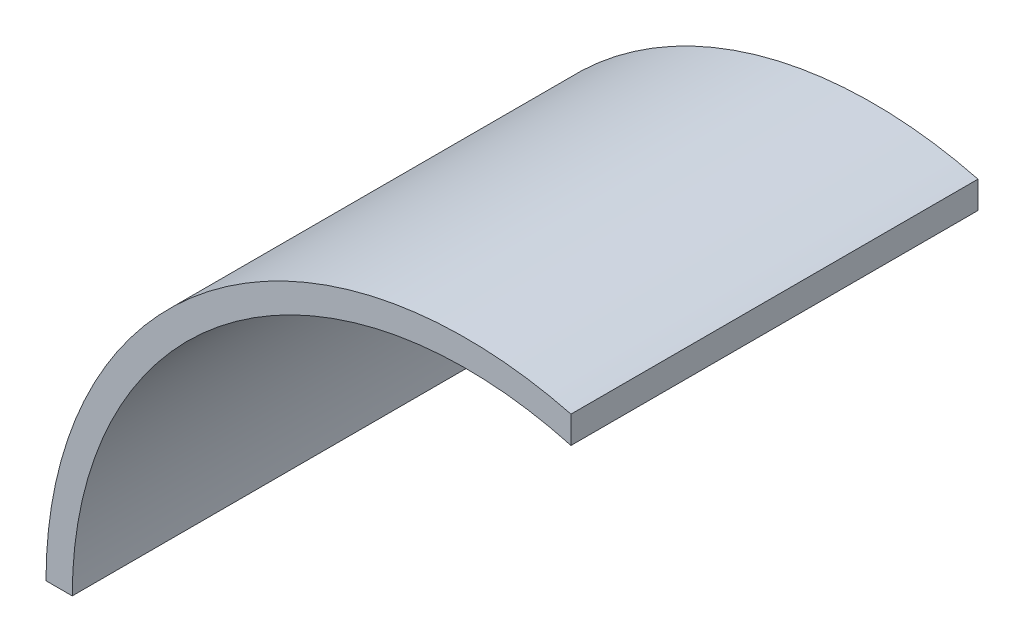
from build123d import *

# Parameters (mm, degrees)
INNER_RING_LEFT_SIDE_DEPTH = 155


with BuildPart() as part:
    # Sketch1 → Inner Ring - Left Side (new body)
    with BuildSketch(Plane.XY):
        with BuildLine():
            Line((39.934342091, 154.936271808), (39.934342091, 144.586473509))
            ThreePointArc((39.934342091, 144.586473509), (-90.856614196, 119.352736277), (-150, 0))
            Line((-150, 0), (-160, 0))
            ThreePointArc((-160, 0), (-98.006390775, 126.470341849), (39.934342091, 154.936271808))
        make_face()
    extrude(amount=INNER_RING_LEFT_SIDE_DEPTH)


solid = part.part
